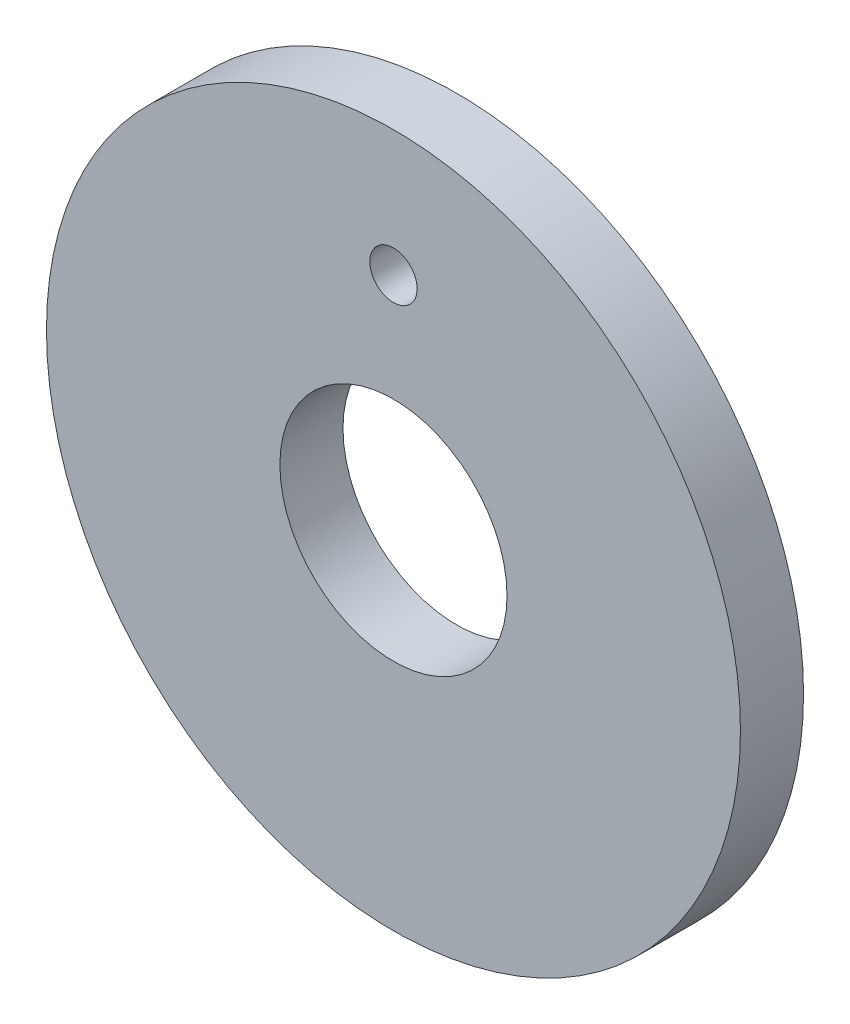
from build123d import *

# Parameters (mm, degrees)
MODEL_R                = 11
MODEL_R_2              = 0.75
MODEL_R_3              = 3.6
AX12_PULLEY_BODY_DEPTH = 2


# Read off the part's stored shape, not the designer's step: RobotHandParameters
with BuildPart() as part:
    # Model → AX12 pulley Body (new body)
    with BuildSketch(Plane.XY):
        Circle(MODEL_R)
        with Locations((0, 7)):
            Circle(MODEL_R_2, mode=Mode.SUBTRACT)
        Circle(MODEL_R_3, mode=Mode.SUBTRACT)
    extrude(amount=AX12_PULLEY_BODY_DEPTH)


solid = part.part
